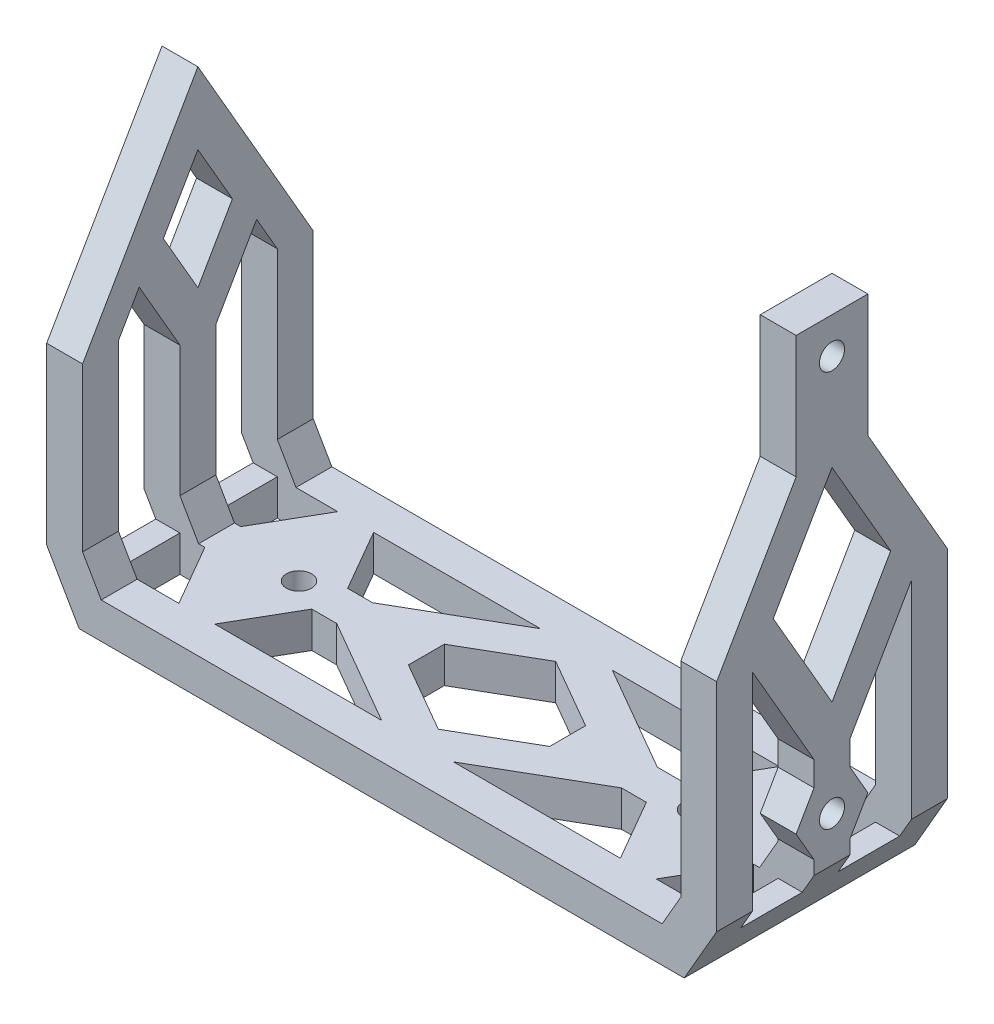
from build123d import *

# Parameters (mm, degrees)
SKETCH1_R               = 1.05
BOSS_EXTRUDE1_DEPTH     = 3
SKETCH4_W               = 3
SKETCH4_H               = 5.139528096
BOSS_EXTRUDE5_DEPTH     = 3
MIRROR3_COPY_1_SKETCH_W = 3
MIRROR3_COPY_1_SKETCH_H = 5.139528096
MIRROR3_COPY_1_DEPTH    = 3
SKETCH5_R               = 1.05
BOSS_EXTRUDE6_DEPTH     = 3
CHAMFER2_SIZE           = 10
CHAMFER2_SIZE_2         = 5.773502692
BOSS_EXTRUDE8_DEPTH     = 3
CUT_EXTRUDE3_DEPTH      = 19.279056191
CHAMFER4_SIZE           = 2.7
CHAMFER4_SIZE_2         = 1.558845727
CHAMFER5_SIZE           = 2.713546265
CHAMFER5_SIZE_2         = 4.7


with BuildPart() as part:
    # Sketch1 → Boss-Extrude1 (new body)
    with BuildSketch(Plane(origin=(0, 0, 0), x_dir=(1, 0, 0), z_dir=(0, 1, 0))):
        Polygon((-28, -1.5), (-28, 1.5), (-11.901923789, 1.5), (-3, 6.639528096), (-28, 6.639528096), (-28, 9.639528096), (28, 9.639528096), (28, 6.639528096), (3, 6.639528096), (11.901923789, 1.5), (28, 1.5), (28, -1.5), (11.901923789, -1.5), (3, -6.639528096), (28, -6.639528096), (28, -9.639528096), (-28, -9.639528096), (-28, -6.639528096), (-3, -6.639528096), (-11.901923789, -1.5), align=None)
        with Locations(Location((-16.55, 0, 0), (0, 0, 270))):
            Circle(SKETCH1_R, mode=Mode.SUBTRACT)
        with Locations(Location((16.55, 0, 0), (0, 0, 270))):
            Circle(SKETCH1_R, mode=Mode.SUBTRACT)
        Polygon((-5.901923789, 1.5), (0, 4.907477288), (5.901923789, 1.5), (5.901923789, -1.5), (0, -4.907477288), (-5.901923789, -1.5), align=None, mode=Mode.SUBTRACT)
    extrude(amount=-BOSS_EXTRUDE1_DEPTH)

    # Sketch4 → Boss-Extrude5 (add)
    with BuildSketch(Plane(origin=(0, 0, 0), x_dir=(1, 0, 0), z_dir=(0, 1, 0))):
        with Locations((-26.5, 4.069764048)):
            Rectangle(SKETCH4_W, SKETCH4_H)
        Polygon((-13.983653965, 1.5), (-16.950961894, 6.639528096), (-19.950961894, 6.639528096), (-22.918269824, 1.5), align=None)
    boss_extrude5 = extrude(amount=-BOSS_EXTRUDE5_DEPTH)

    # Mirror2: Boss-Extrude5 across plane
    add(boss_extrude5.mirror(Plane.XY))

    # Mirror3: Boss-Extrude5 across plane
    add(boss_extrude5.mirror(Plane(origin=(0, 0, 0), x_dir=(0, 0, 1), z_dir=(1, 0, 0))))

    # Mirror3 copy 1 sketch → Mirror3 copy 1 (add)
    with BuildSketch(Plane(origin=(0, 0, 0), x_dir=(-1, 0, 0), z_dir=(0, 1, 0))):
        with Locations((-26.5, 4.069764048)):
            Rectangle(MIRROR3_COPY_1_SKETCH_W, MIRROR3_COPY_1_SKETCH_H)
        Polygon((-13.983653965, 1.5), (-16.950961894, 6.639528096), (-19.950961894, 6.639528096), (-22.918269824, 1.5), align=None)
    extrude(amount=-MIRROR3_COPY_1_DEPTH)

    # Sketch5 → Boss-Extrude6 (add)
    with BuildSketch(Plane(origin=(28, 0, 0), x_dir=(0, 0, -1), z_dir=(1, 0, 0))):
        Polygon((-1.5, 0), (1.5, 0), (1.5, 2.851923789), (3, 5.45), (1.5, 8.048076211), (1.5, 10.098076211), (6.639528096, 19), (6.639528096, 0), (9.639528096, 0), (9.639528096, 19.803847577), (6.639528096, 25), (3, 31.303847577), (3, 41.55), (-3, 41.55), (-3, 31.303847577), (-6.639528096, 25), (-9.639528096, 19.803847577), (-9.639528096, 0), (-6.639528096, 0), (-6.639528096, 19), (-1.5, 10.098076211), (-1.5, 8.048076211), (-3, 5.45), (-1.5, 2.851923789), align=None)
        with Locations((0, 38.55)):
            Circle(SKETCH5_R, mode=Mode.SUBTRACT)
        with Locations((0, 5.45)):
            Circle(SKETCH5_R, mode=Mode.SUBTRACT)
        Polygon((-1.5, 27.901923789), (-4.907477288, 22), (-1.5, 16.098076211), (0, 13.5), (1.5, 16.098076211), (4.907477288, 22), (1.5, 27.901923789), (0, 30.5), align=None, mode=Mode.SUBTRACT)
    extrude(amount=-BOSS_EXTRUDE6_DEPTH)

    # Chamfer2
    # the kernel refuses this chamfer: 10, 5.773502692 mm, written as the material it adds along each edge
    with BuildSketch(Plane(origin=(25, 0, 19.231329451), x_dir=(0.019326765612700636, 0.9998132206222079, 0), z_dir=(0, 0, -1))) as chamfer2_piece_1_section:
        Polygon((CHAMFER2_SIZE * 0.999813220622, -CHAMFER2_SIZE * 0.0193267656127), (-CHAMFER2_SIZE_2 * 0.0193267656124, -CHAMFER2_SIZE_2 * 0.999813220604), (0, 0), align=None)
    chamfer2_piece_1 = extrude(amount=54.741715093, mode=Mode.PRIVATE)
    chamfer2_piece_1 = split(chamfer2_piece_1, bisect_by=Plane(origin=(23.083170395, 3.339976868, 9.639528096), z_dir=(0, 0, -1)), keep=Keep.TOP, mode=Mode.PRIVATE)
    chamfer2_piece_1 = split(chamfer2_piece_1, bisect_by=Plane(origin=(23.083170395, 3.339976868, 6.639528096), z_dir=(0, 0, 1)), keep=Keep.TOP, mode=Mode.PRIVATE)
    add(chamfer2_piece_1)
    with BuildSketch(Plane(origin=(25, 0, 19.231329451), x_dir=(0.019326765612700636, 0.9998132206222079, 0), z_dir=(0, 0, -1))) as chamfer2_piece_2_section:
        Polygon((CHAMFER2_SIZE * 0.999813220622, -CHAMFER2_SIZE * 0.0193267656127), (-CHAMFER2_SIZE_2 * 0.0193267656124, -CHAMFER2_SIZE_2 * 0.999813220604), (0, 0), align=None)
    chamfer2_piece_2 = extrude(amount=54.741715093, mode=Mode.PRIVATE)
    chamfer2_piece_2 = chamfer2_piece_2 - Plane(origin=(20.16592145, 5.45, 0), x_dir=(0, 0, -1), z_dir=(1, 0, 0)) * Cylinder(1.05, 150, mode=Mode.PRIVATE)
    chamfer2_piece_2 = split(chamfer2_piece_2, bisect_by=Plane(origin=(20.36501826, 1.167335957, 5.922361434), z_dir=(-0.8660254037844365, 0, -0.5000000000000038)), keep=Keep.TOP, mode=Mode.PRIVATE)
    chamfer2_piece_2 = split(chamfer2_piece_2, bisect_by=Plane(origin=(20.16592145, 1.167335957, -1.5), z_dir=(0, 0, 1)), keep=Keep.TOP, mode=Mode.PRIVATE)
    add(chamfer2_piece_2)
    with BuildSketch(Plane(origin=(25, 0, 19.231329451), x_dir=(0.019326765612700636, 0.9998132206222079, 0), z_dir=(0, 0, -1))) as chamfer2_piece_3_section:
        Polygon((CHAMFER2_SIZE * 0.999813220622, -CHAMFER2_SIZE * 0.0193267656127), (-CHAMFER2_SIZE_2 * 0.0193267656124, -CHAMFER2_SIZE_2 * 0.999813220604), (0, 0), align=None)
    chamfer2_piece_3 = extrude(amount=54.741715093, mode=Mode.PRIVATE)
    chamfer2_piece_3 = chamfer2_piece_3 - Plane(origin=(24.384879917, 5.45, 0), x_dir=(0, 0, -1), z_dir=(1, 0, 0)) * Cylinder(1.05, 150, mode=Mode.PRIVATE)
    chamfer2_piece_3 = split(chamfer2_piece_3, bisect_by=Plane(origin=(24.384879917, 8.598015425, 1.5), z_dir=(0, 0, -1)), keep=Keep.TOP, mode=Mode.PRIVATE)
    chamfer2_piece_3 = split(chamfer2_piece_3, bisect_by=Plane(origin=(24.384879917, 8.598015425, -1.5), z_dir=(0, 0, 1)), keep=Keep.TOP, mode=Mode.PRIVATE)
    add(chamfer2_piece_3)
    with BuildSketch(Plane(origin=(25, 0, 19.231329451), x_dir=(0.019326765612700636, 0.9998132206222079, 0), z_dir=(0, 0, -1))) as chamfer2_piece_4_section:
        Polygon((CHAMFER2_SIZE * 0.999813220622, -CHAMFER2_SIZE * 0.0193267656127), (-CHAMFER2_SIZE_2 * 0.0193267656124, -CHAMFER2_SIZE_2 * 0.999813220604), (0, 0), align=None)
    chamfer2_piece_4 = extrude(amount=54.741715093, mode=Mode.PRIVATE)
    chamfer2_piece_4 = split(chamfer2_piece_4, bisect_by=Plane(origin=(22.219816408, 4.29897732, -1.5), z_dir=(0, 0, -1)), keep=Keep.TOP, mode=Mode.PRIVATE)
    chamfer2_piece_4 = split(chamfer2_piece_4, bisect_by=Plane(origin=(22.603293948, 4.29897732, -2.04555422), z_dir=(-0.8660254037844365, 0, 0.5000000000000038)), keep=Keep.TOP, mode=Mode.PRIVATE)
    add(chamfer2_piece_4)
    with BuildSketch(Plane(origin=(25, 0, -6.639528096), x_dir=(0.019326765612700636, 0.9998132206222079, 0), z_dir=(0, 0, -1))) as chamfer2_piece_5:
        Polygon((CHAMFER2_SIZE * 0.999813220622, -CHAMFER2_SIZE * 0.0193267656127), (-CHAMFER2_SIZE_2 * 0.0193267656124, -CHAMFER2_SIZE_2 * 0.999813220604), (0, 0), align=None)
    extrude(amount=3)

    # Sketch8 → Boss-Extrude8 (add)
    with BuildSketch(Plane.ZY.offset(28)):
        Polygon((0, 33), (-6.350852961, 22), (-9.639528096, 16.303847577), (-9.639528096, 0), (-6.639528096, 0), (-6.639528096, 16.5), (-4.907477288, 19.5), (-1.5, 13.598076211), (-1.5, 0), (1.5, 0), (1.5, 13.598076211), (4.907477288, 19.5), (6.639528096, 16.5), (6.639528096, 0), (9.639528096, 0), (9.639528096, 16.303847577), (6.350852961, 22), align=None)
        Polygon((0, 17), (2.886751346, 22), (0, 27), (-2.886751346, 22), align=None, mode=Mode.SUBTRACT)
    extrude(amount=-BOSS_EXTRUDE8_DEPTH)

    # Sketch11 → Cut-Extrude3 (cut)
    with BuildSketch(Plane(origin=(0, 0, -9.639528096), x_dir=(-1, 0, 0), z_dir=(0, 0, -1))):
        Polygon((-19.226497308, 0), (-25, 0), (-25, 10), align=None)
    extrude(amount=-CUT_EXTRUDE3_DEPTH, mode=Mode.SUBTRACT)

    # Chamfer4
    # the kernel refuses this chamfer: 2.7, 1.558845727 mm, written as the material it adds along each edge
    with BuildSketch(Plane(origin=(-25, 0, -0.345603442), x_dir=(-0.019326765612700168, 0.9998132206222078, 0), z_dir=(0, 0, 1))) as chamfer4_piece_1_section:
        Polygon((CHAMFER4_SIZE * 0.999813220622, -CHAMFER4_SIZE * 0.0193267656127), (-CHAMFER4_SIZE_2 * 0.0193267656104, -CHAMFER4_SIZE_2 * 0.999813220502), (0, 0), align=None)
    chamfer4_piece_1 = extrude(amount=9.985131538, mode=Mode.PRIVATE)
    chamfer4_piece_1 = split(chamfer4_piece_1, bisect_by=Plane(origin=(-24.500125104, 0.905532133, 1.5), z_dir=(0, 0, -1)), keep=Keep.TOP, mode=Mode.PRIVATE)
    add(chamfer4_piece_1)
    with BuildSketch(Plane(origin=(-25, 0, 6.639528096), x_dir=(-0.019326765612700168, 0.9998132206222078, 0), z_dir=(0, 0, 1)), Plane(origin=(-25, 0, -1.5), x_dir=(-0.019326765612700168, 0.9998132206222078, 0), z_dir=(0, 0, 1)), Plane(origin=(-25, 0, -9.639528096), x_dir=(-0.019326765612701444, 0.9998132206222078, 0), z_dir=(0, 0, 1))) as chamfer4_piece_2:
        Polygon((CHAMFER4_SIZE * 0.999813220622, -CHAMFER4_SIZE * 0.0193267656127), (-CHAMFER4_SIZE_2 * 0.0193267656104, -CHAMFER4_SIZE_2 * 0.999813220502), (0, 0), align=None)
    extrude(amount=3)
    with BuildSketch(Plane(origin=(-25, 0, -8.485131538), x_dir=(-0.019326765612700168, 0.9998132206222078, 0), z_dir=(0, 0, 1))) as chamfer4_piece_3_section:
        Polygon((CHAMFER4_SIZE * 0.999813220622, -CHAMFER4_SIZE * 0.0193267656127), (-CHAMFER4_SIZE_2 * 0.0193267656104, -CHAMFER4_SIZE_2 * 0.999813220502), (0, 0), align=None)
    chamfer4_piece_3 = extrude(amount=9.985131538, mode=Mode.PRIVATE)
    chamfer4_piece_3 = split(chamfer4_piece_3, bisect_by=Plane(origin=(-24.500125104, 0.905532133, -6.639528096), z_dir=(0, 0, -1)), keep=Keep.TOP, mode=Mode.PRIVATE)
    add(chamfer4_piece_3)
    with BuildSketch(Plane(origin=(-25, 0, -1.5), x_dir=(-0.019326765612700168, 0.9998132206222078, 0), z_dir=(0, 0, 1))) as chamfer4_piece_4_section:
        Polygon((CHAMFER4_SIZE * 0.999813220622, -CHAMFER4_SIZE * 0.0193267656127), (-CHAMFER4_SIZE_2 * 0.0193267656104, -CHAMFER4_SIZE_2 * 0.999813220502), (0, 0), align=None)
    chamfer4_piece_4 = extrude(amount=9.985131538, mode=Mode.PRIVATE)
    chamfer4_piece_4 = split(chamfer4_piece_4, bisect_by=Plane(origin=(-24.500125104, 0.905532133, 6.639528096), z_dir=(0, 0, 1)), keep=Keep.TOP, mode=Mode.PRIVATE)
    add(chamfer4_piece_4)
    with BuildSketch(Plane(origin=(-25, 0, -9.639528096), x_dir=(-0.019326765612701444, 0.9998132206222078, 0), z_dir=(0, 0, 1))) as chamfer4_piece_5_section:
        Polygon((CHAMFER4_SIZE * 0.999813220622, -CHAMFER4_SIZE * 0.0193267656127), (-CHAMFER4_SIZE_2 * 0.0193267656104, -CHAMFER4_SIZE_2 * 0.999813220502), (0, 0), align=None)
    chamfer4_piece_5 = extrude(amount=9.985131538, mode=Mode.PRIVATE)
    chamfer4_piece_5 = split(chamfer4_piece_5, bisect_by=Plane(origin=(-24.500125104, 0.905532133, -1.5), z_dir=(0, 0, 1)), keep=Keep.TOP, mode=Mode.PRIVATE)
    add(chamfer4_piece_5)
    with BuildSketch(Plane(origin=(25, 0, -0.345603442), x_dir=(0.019326765612700168, 0.9998132206222078, 0), z_dir=(0, 0, 1))) as chamfer4_piece_6_section:
        Polygon((CHAMFER4_SIZE * 0.999813220622, CHAMFER4_SIZE * 0.0193267656127), (-CHAMFER4_SIZE_2 * 0.0193267656104, CHAMFER4_SIZE_2 * 0.999813220502), (0, 0), align=None)
    chamfer4_piece_6 = extrude(amount=9.985131537, mode=Mode.PRIVATE)
    chamfer4_piece_6 = split(chamfer4_piece_6, bisect_by=Plane(origin=(24.500125104, 0.905532133, 1.5), z_dir=(0, 0, -1)), keep=Keep.TOP, mode=Mode.PRIVATE)
    add(chamfer4_piece_6)
    with BuildSketch(Plane(origin=(25, 0, 6.639528096), x_dir=(0.01932676561269762, 0.999813220622208, 0), z_dir=(0, 0, 1)), Plane(origin=(25, 0, -1.5), x_dir=(0.01932676561269762, 0.999813220622208, 0), z_dir=(0, 0, 1)), Plane(origin=(25, 0, -9.639528096), x_dir=(0.019326765612698894, 0.999813220622208, 0), z_dir=(0, 0, 1))) as chamfer4_piece_7:
        Polygon((CHAMFER4_SIZE * 0.999813220622, CHAMFER4_SIZE * 0.0193267656127), (-CHAMFER4_SIZE_2 * 0.0193267656104, CHAMFER4_SIZE_2 * 0.999813220502), (0, 0), align=None)
    extrude(amount=3)
    with BuildSketch(Plane(origin=(25, 0, -8.485131538), x_dir=(0.019326765612700168, 0.9998132206222078, 0), z_dir=(0, 0, 1))) as chamfer4_piece_8_section:
        Polygon((CHAMFER4_SIZE * 0.999813220622, CHAMFER4_SIZE * 0.0193267656127), (-CHAMFER4_SIZE_2 * 0.0193267656104, CHAMFER4_SIZE_2 * 0.999813220502), (0, 0), align=None)
    chamfer4_piece_8 = extrude(amount=9.985131538, mode=Mode.PRIVATE)
    chamfer4_piece_8 = split(chamfer4_piece_8, bisect_by=Plane(origin=(24.500125104, 0.905532133, -6.639528096), z_dir=(0, 0, -1)), keep=Keep.TOP, mode=Mode.PRIVATE)
    add(chamfer4_piece_8)
    with BuildSketch(Plane(origin=(25, 0, -1.5), x_dir=(0.01932676561269762, 0.999813220622208, 0), z_dir=(0, 0, 1))) as chamfer4_piece_9_section:
        Polygon((CHAMFER4_SIZE * 0.999813220622, CHAMFER4_SIZE * 0.0193267656127), (-CHAMFER4_SIZE_2 * 0.0193267656104, CHAMFER4_SIZE_2 * 0.999813220502), (0, 0), align=None)
    chamfer4_piece_9 = extrude(amount=9.985131538, mode=Mode.PRIVATE)
    chamfer4_piece_9 = split(chamfer4_piece_9, bisect_by=Plane(origin=(24.500125104, 0.905532133, 6.639528096), z_dir=(0, 0, 1)), keep=Keep.TOP, mode=Mode.PRIVATE)
    add(chamfer4_piece_9)
    with BuildSketch(Plane(origin=(25, 0, -9.639528096), x_dir=(0.019326765612698894, 0.999813220622208, 0), z_dir=(0, 0, 1))) as chamfer4_piece_10_section:
        Polygon((CHAMFER4_SIZE * 0.999813220622, CHAMFER4_SIZE * 0.0193267656127), (-CHAMFER4_SIZE_2 * 0.0193267656104, CHAMFER4_SIZE_2 * 0.999813220502), (0, 0), align=None)
    chamfer4_piece_10 = extrude(amount=9.985131538, mode=Mode.PRIVATE)
    chamfer4_piece_10 = split(chamfer4_piece_10, bisect_by=Plane(origin=(24.500125104, 0.905532133, -1.5), z_dir=(0, 0, 1)), keep=Keep.TOP, mode=Mode.PRIVATE)
    add(chamfer4_piece_10)

    # Chamfer5
    # the kernel refuses this chamfer: 4.7, 2.713546265 mm, written as the material it takes off along each edge
    with BuildSketch(Plane(origin=(28, -3, -21.798831143), x_dir=(-0.9983227437537925, -0.0578938624026708, 0), z_dir=(0, 0, 1))) as chamfer5_piece_1:
        Polygon((CHAMFER5_SIZE * 0.998322743824, -CHAMFER5_SIZE * 0.0578938624068), (-CHAMFER5_SIZE_2 * 0.0578938624027, -CHAMFER5_SIZE_2 * 0.998322743754), (0, 0), align=None)
    extrude(amount=43.597662285, mode=Mode.SUBTRACT)
    with BuildSketch(Plane(origin=(-28, -3, -21.798831143), x_dir=(0.9983227437537925, -0.0578938624026708, 0), z_dir=(0, 0, 1))) as chamfer5_piece_2:
        Polygon((CHAMFER5_SIZE * 0.998322743824, CHAMFER5_SIZE * 0.0578938624068), (-CHAMFER5_SIZE_2 * 0.0578938624027, CHAMFER5_SIZE_2 * 0.998322743754), (0, 0), align=None)
    extrude(amount=43.597662285, mode=Mode.SUBTRACT)


solid = part.part
